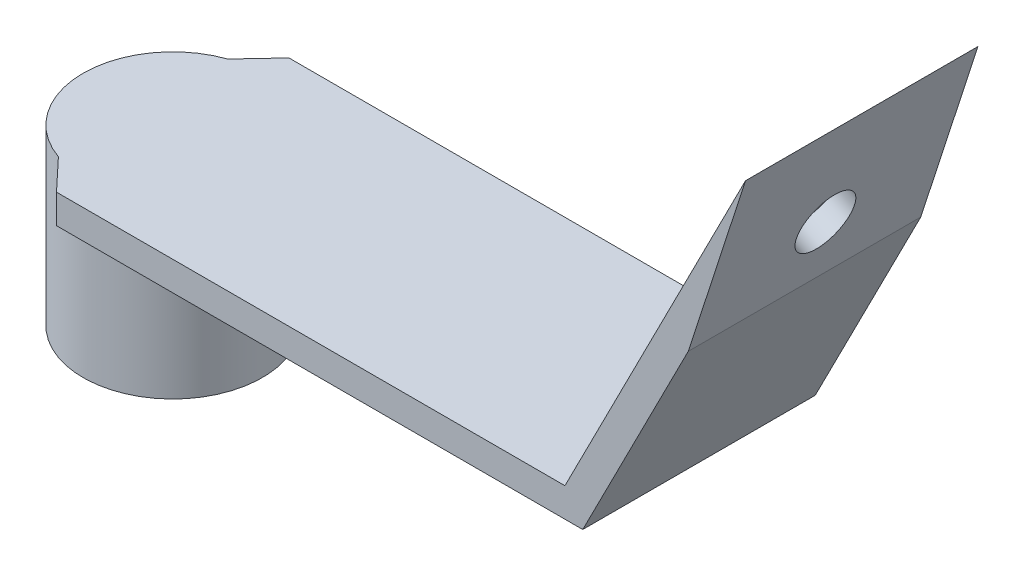
from build123d import *

# Parameters (mm, degrees)
BOSS_EXTRUDE1_DEPTH = 25.4
SKETCH2_R           = 9.801448676
SKETCH2_R_2         = 7.071368029
BOSS_EXTRUDE2_DEPTH = 19
BOSS_EXTRUDE3_DEPTH = 3.175
SKETCH4_R           = 3.175
CUT_EXTRUDE1_DEPTH  = 3.175


with BuildPart() as part:
    # Sketch1 → Boss-Extrude1 (new body)
    with BuildSketch(Plane.XY):
        Polygon((-76.495819173, -3.422180745), (-20.941461675, -3.422180745), (-1.20885062, 35.305249012), (-7.464460479, 16.03438497), (-18.995819173, -6.597180745), (-76.495819173, -6.597180745), align=None)
    extrude(amount=BOSS_EXTRUDE1_DEPTH)

    # Sketch2 → Boss-Extrude2 (add)
    with BuildSketch(Plane(origin=(0, -3.422180745, 0), x_dir=(1, 0, 0), z_dir=(0, 1, 0))):
        with Locations((-76.495819173, -12.7)):
            Circle(SKETCH2_R)
        with Locations((-76.495819173, -12.7)):
            Circle(SKETCH2_R_2, mode=Mode.SUBTRACT)
    extrude(amount=-BOSS_EXTRUDE2_DEPTH)

    # Sketch3 → Boss-Extrude3 (add)
    with BuildSketch(Plane(origin=(0, -3.422180745, 0), x_dir=(1, 0, 0), z_dir=(0, 1, 0))):
        Polygon((-76.495819173, 0), (-85.929582176, -10.040580563), (-86.297267848, -12.7), (-85.929582176, -15.359419437), (-76.495819173, -25.4), align=None)
    extrude(amount=-BOSS_EXTRUDE3_DEPTH)

    # Sketch4 → Cut-Extrude1 (cut)
    with BuildSketch(Plane(origin=(-15.240970814, 7.765662505, 0), x_dir=(0, 0, 1), z_dir=(-0.8910065241883692, 0.45399049973954403, 0))):
        with Locations((12.7, 18.20840051)):
            Circle(SKETCH4_R)
    extrude(amount=-CUT_EXTRUDE1_DEPTH, mode=Mode.SUBTRACT)


solid = part.part
